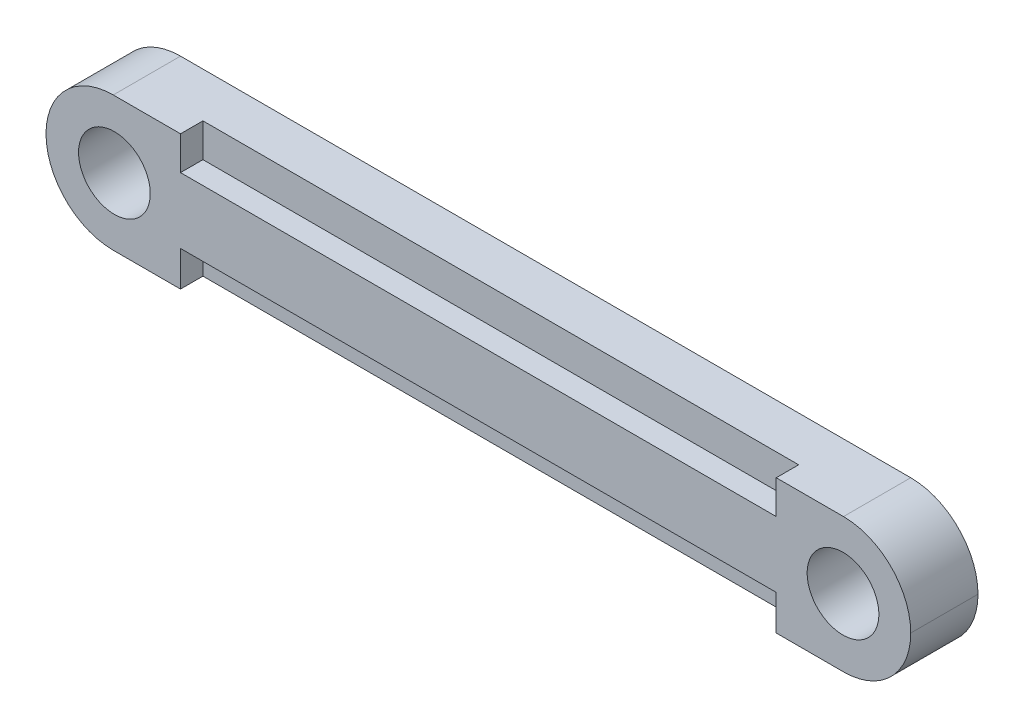
from build123d import *

# Parameters (mm, degrees)
SZKIC1_W                        = 38.573617051
SZKIC1_H                        = 6
DODANIE_WYCI_GNI_CIE1_DEPTH     = 2
WYTNIJ_WYCI_GNI_CIE2_DEPTH      = 1
WYTNIJ_WYCI_GNI_CIE2_DEPTH_BACK = 38.075597401
SZKIC3_R                        = 1.6
DODANIE_WYCI_GNI_CIE2_DEPTH     = 1
SZKIC5_R                        = 1.6
WYTNIJ_WYCI_GNI_CIE3_DEPTH      = 38.142965991
ZAOKR_GLENIE1_R                 = 3


with BuildPart() as part:
    # Szkic1 → Dodanie-wyciągnięcie1 (new body)
    with BuildSketch(Plane.XY):
        with Locations((-15.012785421, 10.933333333)):
            Rectangle(SZKIC1_W, SZKIC1_H)
    extrude(amount=DODANIE_WYCI_GNI_CIE1_DEPTH)

    # Szkic3 → Wytnij-wyciągnięcie2 (cut, two sides: drawn at the far end of the back side and taken through both)
    with BuildSketch(Plane.XY.offset(2).offset(-WYTNIJ_WYCI_GNI_CIE2_DEPTH_BACK)):
        with Locations((-31.24872203, 10.943210033)):
            Circle(SZKIC3_R)
        with Locations((1.25127797, 10.943210033)):
            Circle(SZKIC3_R)
    extrude(amount=WYTNIJ_WYCI_GNI_CIE2_DEPTH + WYTNIJ_WYCI_GNI_CIE2_DEPTH_BACK, mode=Mode.SUBTRACT)

    # Szkic4 → Dodanie-wyciągnięcie2 (add)
    with BuildSketch(Plane.XY.offset(2)):
        Polygon((-34.299593946, 13.933333333), (-28.299593946, 13.933333333), (-28.299593946, 12.433333333), (-1.725976895, 12.433333333), (-1.725976895, 13.933333333), (4.274023105, 13.933333333), (4.274023105, 7.933333333), (-1.725976895, 7.933333333), (-1.725976895, 9.504700568), (-28.299593946, 9.504700568), (-28.299593946, 7.933333333), (-34.299593946, 7.933333333), align=None)
    extrude(amount=DODANIE_WYCI_GNI_CIE2_DEPTH)

    # Szkic5 → Wytnij-wyciągnięcie3 (cut, through all)
    with BuildSketch(Plane(origin=(0, 0, 0), x_dir=(-1, 0, 0), z_dir=(0, 0, -1))):
        with Locations((-1.25127797, 10.943210033)):
            Circle(SZKIC5_R)
        with Locations((31.24872203, 10.943210033)):
            Circle(SZKIC5_R)
    extrude(amount=-WYTNIJ_WYCI_GNI_CIE3_DEPTH, mode=Mode.SUBTRACT)

    # Zaokrąglenie1
    zaokr_glenie1_edges = [part.edges().sort_by_distance(p)[0] for p in [
        (-34.299593946, 7.933333333, 1.5),
        (-34.299593946, 13.933333333, 1.5),
        (4.274023105, 7.933333333, 1.5),
        (4.274023105, 13.933333333, 1.5),
    ]]
    fillet(zaokr_glenie1_edges, radius=ZAOKR_GLENIE1_R - 0.0001)  # a hair under: the kernel refuses the full size


solid = part.part
